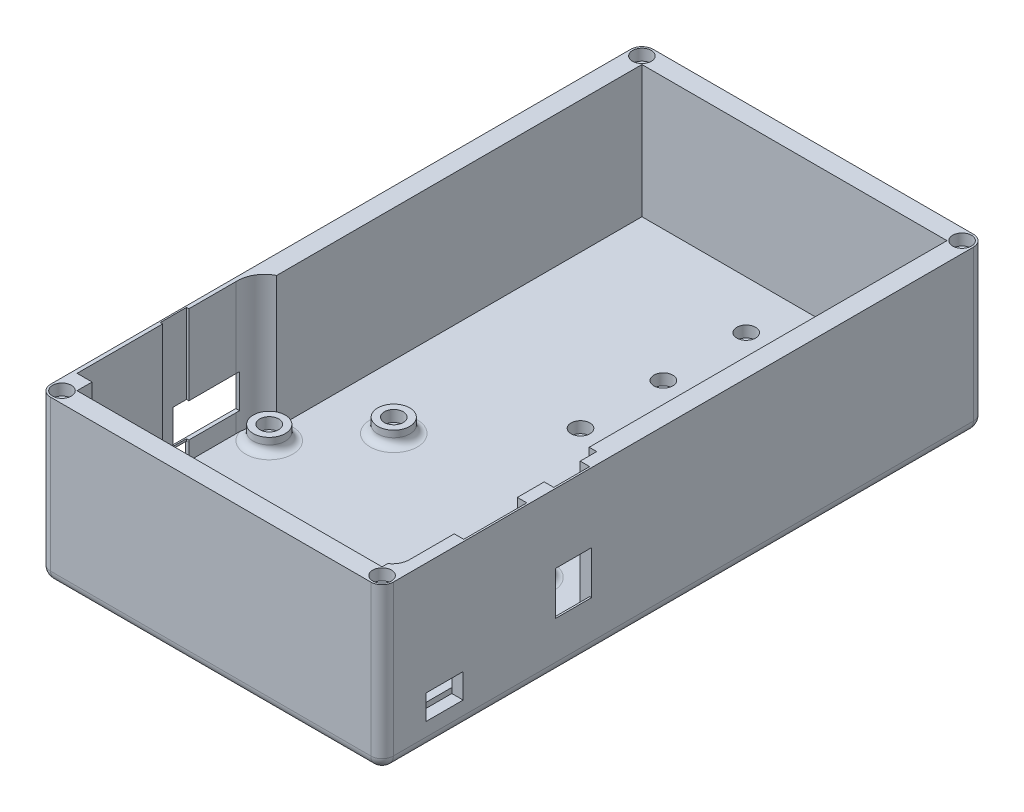
from build123d import *

# Parameters (mm, degrees)
SKETCH1_W           = 91
SKETCH1_H           = 160
BOSS_EXTRUDE1_DEPTH = 8
BOSS_EXTRUDE4_DEPTH = 35
SKETCH5_R           = 4.25
BOSS_EXTRUDE5_DEPTH = 3.75
BOSS_EXTRUDE6_DEPTH = 35
SKETCH7_W           = 2.52
SKETCH7_H           = 9.55
SKETCH7_H_2         = 16.76
SKETCH7_W_2         = 0.63
SKETCH7_H_3         = 6.95
CUT_EXTRUDE1_DEPTH  = 35
SKETCH8_R           = 2.5
CUT_EXTRUDE2_DEPTH  = 3
SKETCH9_R           = 2.5
CUT_EXTRUDE3_DEPTH  = 3
FILLET2_R           = 2
SKETCH10_W          = 9.9
SKETCH10_H          = 6.55
SKETCH10_W_2        = 9.5
SKETCH10_H_2        = 11.5
CUT_EXTRUDE4_DEPTH  = 3
SKETCH11_W          = 12.03
SKETCH11_H          = 1.38
SKETCH11_W_2        = 7.21
SKETCH11_H_2        = 3.4
SKETCH11_W_3        = 17
SKETCH11_H_3        = 9
CUT_EXTRUDE5_DEPTH  = 3
SKETCH12_R          = 2.5
CUT_EXTRUDE6_DEPTH  = 3
FILLET3_R           = 3


with BuildPart() as part:
    # Sketch1 → Boss-Extrude1 (new body)
    with BuildSketch(Plane(origin=(0, 0, 0), x_dir=(1, 0, 0), z_dir=(0, 1, 0))):
        Rectangle(SKETCH1_W, SKETCH1_H)
    extrude(amount=BOSS_EXTRUDE1_DEPTH)

    # Sketch4 → Boss-Extrude4 (add)
    with BuildSketch(Plane(origin=(0, 8, 0), x_dir=(1, 0, 0), z_dir=(0, 1, 0))):
        Polygon((-45.5, 80), (-45.5, -22), (-40.5, -22), (-40.5, 75), (40.5, 75), (40.5, -20), (45.5, -20), (45.5, 80), align=None)
        Polygon((-45.5, -80), (45.5, -80), (45.5, -73.5), (40.5, -73.5), (40.5, -75), (-40.5, -75), (-40.5, -71), (-45.5, -71), align=None)
    extrude(amount=BOSS_EXTRUDE4_DEPTH)

    # Sketch5 → Boss-Extrude5 (add)
    with BuildSketch(Plane(origin=(0, 8, 0), x_dir=(1, 0, 0), z_dir=(0, 1, 0))):
        with Locations(Location((23.6185, -7.7762, 0), (0, 0, 90))):
            Circle(SKETCH5_R)
        with Locations(Location((-23.6185, -7.7762, 0), (0, 0, 90))):
            Circle(SKETCH5_R)
        with Locations(Location((27.54, -22.78, 0), (0, 0, 90))):
            Circle(SKETCH5_R)
        with Locations((27.54, -71.04)):
            Circle(SKETCH5_R)
        with Locations((-38.5, -67.865)):
            Circle(SKETCH5_R)
        with Locations(Location((-38.5, -25.958, 0), (0, 0, 90))):
            Circle(SKETCH5_R)
    extrude(amount=BOSS_EXTRUDE5_DEPTH)

    # Sketch6 → Boss-Extrude6 (add)
    with BuildSketch(Plane(origin=(0, 8, 0), x_dir=(1, 0, 0), z_dir=(0, 1, 0))):
        with BuildLine():
            Line((-45.5, -22), (-45.5, -71))
            Line((-45.5, -71), (-44.49, -71))
            Line((-44.49, -71), (-44.49, -28.77))
            ThreePointArc((-44.49, -28.77), (-43.501716646, -24.7916766), (-40.5, -22))
            Line((-40.5, -22), (-45.5, -22))
        make_face()
        with BuildLine():
            Line((45.5, -73.5), (45.5, -20))
            Line((45.5, -20), (42.5, -20))
            Line((42.5, -20), (42.5, -69.77))
            ThreePointArc((42.5, -69.77), (41.952245791, -71.877491041), (40.5, -73.5))
            Line((40.5, -73.5), (45.5, -73.5))
        make_face()
    extrude(amount=BOSS_EXTRUDE6_DEPTH)

    # Sketch7 → Cut-Extrude1 (cut)
    with BuildSketch(Plane(origin=(0, 43, 0), x_dir=(1, 0, 0), z_dir=(0, 1, 0))):
        with Locations((43.76, -29.165)):
            Rectangle(SKETCH7_W, SKETCH7_H)
        with Locations((43.76, -49.45)):
            Rectangle(SKETCH7_W, SKETCH7_H_2)
        with Locations((-44.805, -44.795)):
            Rectangle(SKETCH7_W_2, SKETCH7_H_3)
    extrude(amount=-CUT_EXTRUDE1_DEPTH, mode=Mode.SUBTRACT)

    # Sketch8 → Cut-Extrude2 (cut)
    with BuildSketch(Plane(origin=(0, 8, 0), x_dir=(1, 0, 0), z_dir=(0, 1, 0))):
        with Locations(Location((0, 62.189, 0), (0, 0, 270))):
            Circle(SKETCH8_R)
        with Locations(Location((0, 40.189, 0), (0, 0, 270))):
            Circle(SKETCH8_R)
        with Locations(Location((0, 18.19, 0), (0, 0, 270))):
            Circle(SKETCH8_R)
    extrude(amount=-CUT_EXTRUDE2_DEPTH, mode=Mode.SUBTRACT)

    # Sketch9 → Cut-Extrude3 (cut)
    with BuildSketch(Plane(origin=(0, 11.75, 0), x_dir=(1, 0, 0), z_dir=(0, 1, 0))):
        with Locations(Location((-23.6185, -7.7762, 0), (0, 0, 270))):
            Circle(SKETCH9_R)
        with Locations(Location((23.6185, -7.7762, 0), (0, 0, 270))):
            Circle(SKETCH9_R)
        with Locations(Location((27.54, -22.78, 0), (0, 0, 270))):
            Circle(SKETCH9_R)
        with Locations(Location((-38.5, -25.958, 0), (0, 0, 270))):
            Circle(SKETCH9_R)
        with Locations(Location((-38.5, -67.865, 0), (0, 0, 270))):
            Circle(SKETCH9_R)
        with Locations(Location((27.54, -71.04, 0), (0, 0, 270))):
            Circle(SKETCH9_R)
    extrude(amount=-CUT_EXTRUDE3_DEPTH, mode=Mode.SUBTRACT)

    # Fillet2
    # the kernel refuses this fillet: 2 mm, written as the material it adds along each edge
    with BuildSketch(Plane(origin=(23.6185, 8, 7.7762), x_dir=(0, 0, -1), z_dir=(1, 0, 0))) as fillet2_piece_1:
        with BuildLine():
            CenterArc((4.25 + FILLET2_R, FILLET2_R), FILLET2_R, 180, 90)
            Line((4.25, FILLET2_R), (4.25, 0))
            Line((4.25, 0), (4.25 + FILLET2_R, 0))
        make_face()
    revolve(axis=Axis((23.6185, 8, 7.7762), (0, 1, 0)))
    with BuildSketch(Plane(origin=(-23.6185, 8, 7.7762), x_dir=(0, 0, -1), z_dir=(1, 0, 0))) as fillet2_piece_2:
        with BuildLine():
            CenterArc((4.25 + FILLET2_R, FILLET2_R), FILLET2_R, 180, 90)
            Line((4.25, FILLET2_R), (4.25, 0))
            Line((4.25, 0), (4.25 + FILLET2_R, 0))
        make_face()
    revolve(axis=Axis((-23.6185, 8, 7.7762), (0, 1, 0)))
    with BuildSketch(Plane(origin=(27.54, 8, 22.78), x_dir=(0, 0, -1), z_dir=(1, 0, 0))) as fillet2_piece_3:
        with BuildLine():
            CenterArc((4.25 + FILLET2_R, FILLET2_R), FILLET2_R, 180, 90)
            Line((4.25, FILLET2_R), (4.25, 0))
            Line((4.25, 0), (4.25 + FILLET2_R, 0))
        make_face()
    revolve(axis=Axis((27.54, 8, 22.78), (0, 1, 0)))
    with BuildSketch(Plane(origin=(27.54, 8, 71.04), x_dir=(-0.003141587485864213, 0, 0.9999950652018583), z_dir=(0.9999950652018583, 0, 0.003141587485864213))) as fillet2_piece_4:
        with BuildLine():
            CenterArc((4.25 + FILLET2_R, -FILLET2_R), FILLET2_R, 90, 90)
            Line((4.25, -FILLET2_R), (4.25, 0))
            Line((4.25, 0), (4.25 + FILLET2_R, 0))
        make_face()
    revolve(axis=Axis((27.54, 8, 71.04), (0, -1, 0)), revolution_arc=359.64)
    with BuildSketch(Plane(origin=(-38.5, 8, 67.865), x_dir=(-0.5800002610708566, 0, 0.81461628829636), z_dir=(0.81461628829636, 0, 0.5800002610708566))) as fillet2_piece_5:
        with BuildLine():
            CenterArc((4.25 + FILLET2_R, -FILLET2_R), FILLET2_R, 90, 90)
            Line((4.25, -FILLET2_R), (4.25, 0))
            Line((4.25, 0), (4.25 + FILLET2_R, 0))
        make_face()
    revolve(axis=Axis((-38.5, 8, 67.865), (0, -1, 0)), revolution_arc=359.64)
    with BuildSketch(Plane(origin=(-38.5, 8, 25.958), x_dir=(0, 0, -1), z_dir=(1, 0, 0))) as fillet2_piece_6:
        with BuildLine():
            CenterArc((4.25 + FILLET2_R, FILLET2_R), FILLET2_R, 180, 90)
            Line((4.25, FILLET2_R), (4.25, 0))
            Line((4.25, 0), (4.25 + FILLET2_R, 0))
        make_face()
    revolve(axis=Axis((-38.5, 8, 25.958), (0, 1, 0)))

    # Sketch10 → Cut-Extrude4 (cut)
    with BuildSketch(Plane(origin=(45.5, 0, 0), x_dir=(0, 0, -1), z_dir=(1, 0, 0))):
        with Locations((-63.43, 9.875)):
            Rectangle(SKETCH10_W, SKETCH10_H)
        with Locations((-29.14, 18.85)):
            Rectangle(SKETCH10_W_2, SKETCH10_H_2)
    extrude(amount=-CUT_EXTRUDE4_DEPTH, mode=Mode.SUBTRACT)

    # Sketch11 → Cut-Extrude5 (cut)
    with BuildSketch(Plane.ZY.offset(45.5)):
        with Locations((56.335, 11.09)):
            Rectangle(SKETCH11_W, SKETCH11_H)
        with Locations((44.815, 10.55)):
            Rectangle(SKETCH11_W_2, SKETCH11_H_2)
        with Locations((36.35, 17.325)):
            Rectangle(SKETCH11_W_3, SKETCH11_H_3)
    extrude(amount=-CUT_EXTRUDE5_DEPTH, mode=Mode.SUBTRACT)

    # Sketch12 → Cut-Extrude6 (cut)
    with BuildSketch(Plane(origin=(0, 43, 0), x_dir=(1, 0, 0), z_dir=(0, 1, 0))):
        with Locations(Location((-42.5, 77, 0), (0, 0, 270))):
            Circle(SKETCH12_R)
        with Locations(Location((42.5, 77, 0), (0, 0, 270))):
            Circle(SKETCH12_R)
        with Locations(Location((-42.5, -77, 0), (0, 0, 270))):
            Circle(SKETCH12_R)
        with Locations(Location((42.5, -77, 0), (0, 0, 270))):
            Circle(SKETCH12_R)
    extrude(amount=-CUT_EXTRUDE6_DEPTH, mode=Mode.SUBTRACT)

    # Fillet3
    fillet3_edges = [part.edges().sort_by_distance(p)[0] for p in [
        (0, 0, 80),
        (-45.5, 0, 0),
        (0, 0, -80),
        (45.5, 0, 0),
        (45.5, 21.5, 80),
        (-45.5, 21.5, 80),
        (-45.5, 21.5, -80),
        (45.5, 21.5, -80),
    ]]
    fillet(fillet3_edges, radius=FILLET3_R)


solid = part.part
